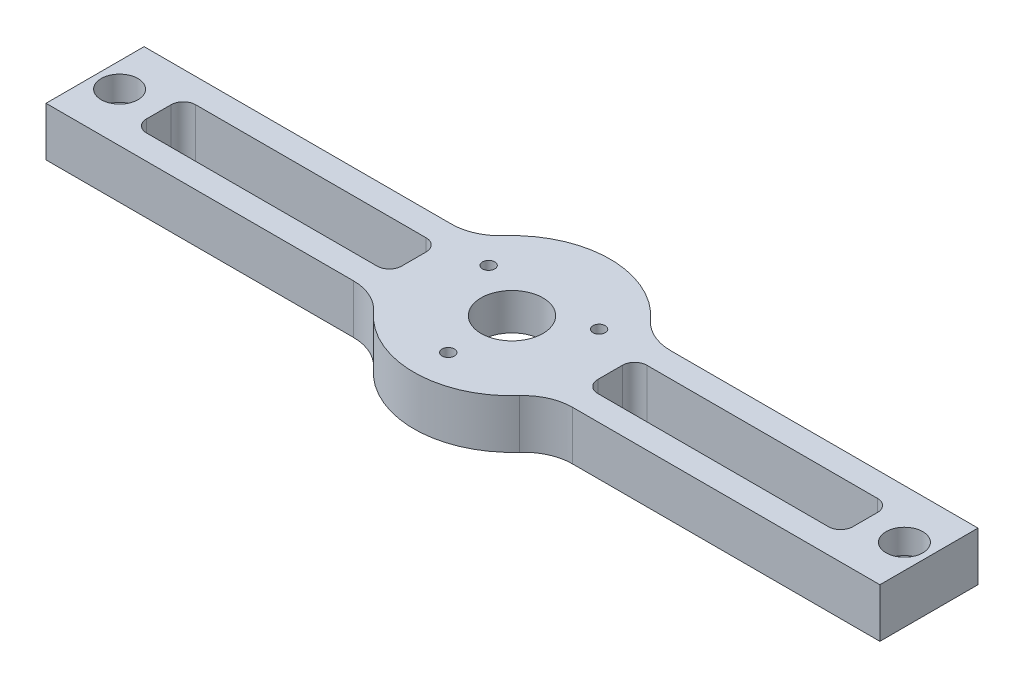
from build123d import *

# Parameters (mm, degrees)
SKETCH2_R           = 8.001
BOSS_EXTRUDE1_DEPTH = 12.7
FILLET1_R           = 12.7
SKETCH3_R           = 22.225
CUT_EXTRUDE1_DEPTH  = 3.175
SKETCH4_R           = 4.7625
CUT_EXTRUDE2_DEPTH  = 6.35
SKETCH5_R           = 3.175
CUT_EXTRUDE3_DEPTH  = 115.652235041
SKETCH6_R           = 1.5875
CUT_EXTRUDE4_DEPTH  = 115.871833471
SKETCH7_W           = 66.04
SKETCH7_H           = 12.7
CUT_EXTRUDE5_DEPTH  = 116.178567885
FILLET2_R           = 3.175


with BuildPart() as part:
    # Sketch2 → Boss-Extrude1 (new body)
    with BuildSketch(Plane(origin=(0, 0, 0), x_dir=(1, 0, 0), z_dir=(0, 1, 0))):
        with BuildLine():
            Line((-107.95, 0), (-107.95, -25.4))
            Line((-107.95, -25.4), (-21.997045256, -25.4))
            ThreePointArc((-21.997045256, -25.4), (0, -38.1), (21.997045256, -25.4))
            Line((21.997045256, -25.4), (107.95, -25.4))
            Line((107.95, -25.4), (107.95, 0))
            Line((107.95, 0), (21.997045256, 0))
            ThreePointArc((21.997045256, 0), (0, 12.7), (-21.997045256, 0))
            Line((-21.997045256, 0), (-107.95, 0))
        make_face()
        with Locations((0, -12.7)):
            Circle(SKETCH2_R, mode=Mode.SUBTRACT)
    extrude(amount=BOSS_EXTRUDE1_DEPTH)

    # Fillet1
    fillet1_edges = [part.edges().sort_by_distance(p)[0] for p in [
        (21.997045256, 6.35, 0),
        (21.997045256, 6.35, 25.4),
        (-21.997045256, 6.35, 25.4),
        (-21.997045256, 6.35, 0),
    ]]
    fillet(fillet1_edges, radius=FILLET1_R)

    # Sketch3 → Cut-Extrude1 (cut)
    with BuildSketch(Plane.XZ):
        with Locations((0, 12.7)):
            Circle(SKETCH3_R)
    extrude(amount=-CUT_EXTRUDE1_DEPTH, mode=Mode.SUBTRACT)

    # Sketch4 → Cut-Extrude2 (cut)
    with BuildSketch(Plane(origin=(0, 12.7, 0), x_dir=(1, 0, 0), z_dir=(0, 1, 0))):
        with Locations((-101.6, -12.7)):
            Circle(SKETCH4_R)
        with Locations((101.6, -12.7)):
            Circle(SKETCH4_R)
    extrude(amount=-CUT_EXTRUDE2_DEPTH, mode=Mode.SUBTRACT)

    # Sketch5 → Cut-Extrude3 (cut, through all)
    with BuildSketch(Plane(origin=(0, 6.35, 0), x_dir=(1, 0, 0), z_dir=(0, 1, 0))):
        with Locations((-101.6, -12.7)):
            Circle(SKETCH5_R)
        with Locations((101.6, -12.7)):
            Circle(SKETCH5_R)
    extrude(amount=-CUT_EXTRUDE3_DEPTH, mode=Mode.SUBTRACT)

    # Sketch6 → Cut-Extrude4 (cut, through all)
    with BuildSketch(Plane.XZ.offset(-3.175)):
        with Locations((0, 29.21)):
            Circle(SKETCH6_R)
        with Locations((14.298079416, 4.445)):
            Circle(SKETCH6_R)
        with Locations((-14.298079416, 4.445)):
            Circle(SKETCH6_R)
    extrude(amount=-CUT_EXTRUDE4_DEPTH, mode=Mode.SUBTRACT)

    # Sketch7 → Cut-Extrude5 (cut, through all)
    with BuildSketch(Plane(origin=(0, 12.7, 0), x_dir=(1, 0, 0), z_dir=(0, 1, 0))):
        with Locations((-58.42, -12.7)):
            Rectangle(SKETCH7_W, SKETCH7_H)
        with Locations((58.42, -12.7)):
            Rectangle(SKETCH7_W, SKETCH7_H)
    extrude(amount=-CUT_EXTRUDE5_DEPTH, mode=Mode.SUBTRACT)

    # Fillet2
    fillet2_edges = [part.edges().sort_by_distance(p)[0] for p in [
        (25.4, 6.35, 6.35),
        (25.4, 6.35, 19.05),
        (91.44, 6.35, 19.05),
        (91.44, 6.35, 6.35),
        (-25.4, 6.35, 6.35),
        (-25.4, 6.35, 19.05),
        (-91.44, 6.35, 19.05),
        (-91.44, 6.35, 6.35),
    ]]
    fillet(fillet2_edges, radius=FILLET2_R)


solid = part.part
